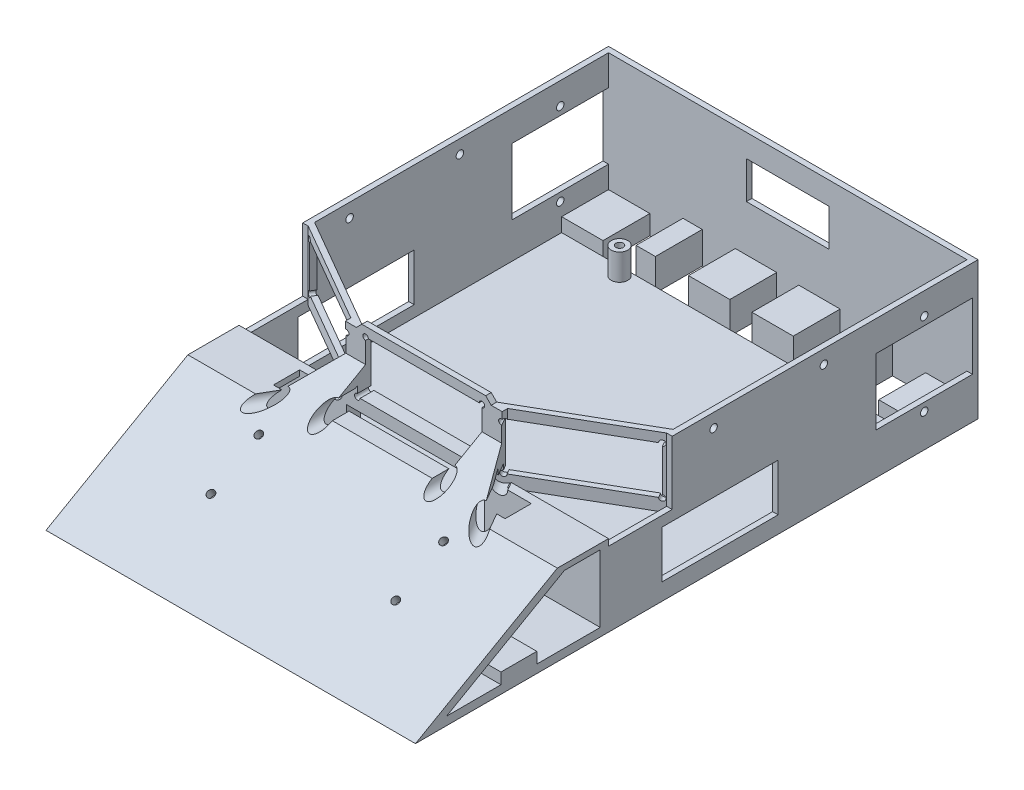
from build123d import *
from build123d.topology import SkipClean

# Parameters (mm, degrees)
SKETCH1_W                  = 130
SKETCH1_H                  = 130
BOSS_EXTRUDE1_DEPTH        = 2
SKETCH1_3_W                = 134
SKETCH1_3_H                = 134
SKETCH1_3_W_2              = 130
SKETCH1_3_H_2              = 130
BOSS_EXTRUDE2_DEPTH        = 50
BOSS_EXTRUDE3_DEPTH        = 134
SKETCH5_W                  = 50
SKETCH5_H                  = 25
CUT_EXTRUDE1_DEPTH         = 5
SKETCH9_R                  = 1.35
CUT_EXTRUDE4_DEPTH         = 3
SKETCH17_W                 = 30
SKETCH17_H                 = 13.5
CUT_EXTRUDE13_DEPTH        = 2
SKETCH19_W                 = 8
SKETCH19_H                 = 13
SKETCH19_R                 = 1.35
CUT_EXTRUDE15_DEPTH        = 3
SKETCH20_R                 = 1
SKETCH20_W                 = 42.2
SKETCH20_H                 = 17.2
FRONT_SENSOR_DEPTH         = 20
CUT_EXTRUDE18_START        = -22.3
SKETCH24_R                 = 3
CUT_EXTRUDE18_DEPTH        = 16.546693
SKETCH21_W                 = 44.9
SKETCH21_H                 = 2
BOSS_EXTRUDE9_DEPTH        = 2
SKETCH26_R                 = 1.35
SKETCH26_W                 = 6
SKETCH26_H                 = 11
SKETCH26_W_2               = 8
SKETCH26_H_2               = 1
SKETCH26_H_3               = 12
CUT_EXTRUDE19_DEPTH        = 2
BOSS_EXTRUDE10_DEPTH       = 25
SKETCH29_R                 = 1
SKETCH29_W                 = 42.2
SKETCH29_H                 = 17.2
CUT_EXTRUDE20_DEPTH        = 50
CUT_EXTRUDE21_DEPTH        = 23
CUT_EXTRUDE22_START        = -2
SKETCH31_R                 = 3
CUT_EXTRUDE22_DEPTH        = 33
CUT_EXTRUDE23_START        = -2
SKETCH32_R                 = 3
CUT_EXTRUDE23_DEPTH        = 33
BOSS_EXTRUDE11_DEPTH       = 25
SKETCH34_W                 = 4
SKETCH34_H                 = 13
CUT_EXTRUDE24_DEPTH        = 3
CUT_EXTRUDE25_START        = -134
SKETCH37_R                 = 1.35
SKETCH37_W                 = 35
SKETCH37_H                 = 24
SKETCH37_R_2               = 3
CUT_EXTRUDE25_DEPTH        = 134
SKETCH40_R                 = 3
CUT_EXTRUDE26_DEPTH        = 134
CUT_EXTRUDE27_REACH        = 200.567
SKETCH42_W                 = 42.2
SKETCH42_H                 = 17.2
CUT_EXTRUDE28_REACH        = 200.567
SKETCH44_R                 = 1.35
BOSS_EXTRUDE12_START       = -7
BOSS_EXTRUDE12_OUTLINE_W   = 17
BOSS_EXTRUDE12_OUTLINE_H   = 13
BOSS_EXTRUDE12_OUTLINE_W_2 = 15
BOSS_EXTRUDE12_OUTLINE_H_2 = 17
BOSS_EXTRUDE12_OUTLINE_W_3 = 7
BOSS_EXTRUDE12_OUTLINE_W_4 = 14.889316973
BOSS_EXTRUDE12_OUTLINE_W_5 = 7.110683027
BOSS_EXTRUDE12_OUTLINE_R   = 3
BOSS_EXTRUDE12_OUTLINE_R_2 = 1.35
BOSS_EXTRUDE12_DEPTH       = 5
SKETCH50_W                 = 4.6
SKETCH50_H                 = 13
CUT_EXTRUDE34_DEPTH        = 1.2
SKETCH51_R                 = 3.1
CUT_EXTRUDE35_DEPTH        = 1.2
SKETCH52_W                 = 12
SKETCH52_H                 = 5
SKETCH52_H_2               = 4
SKETCH52_W_2               = 8
CUT_EXTRUDE36_DEPTH        = 2
SKETCH53_R                 = 3
SKETCH53_R_2               = 1.35
SKETCH53_W                 = 7
SKETCH53_H                 = 17
SKETCH53_W_2               = 15
BOSS_EXTRUDE13_DEPTH       = 4.5


# Read off the part's stored shape, not the designer's step: Boss-Extrude12
with BuildPart() as part:
    # Sketch1 → Boss-Extrude1 (new body)
    with BuildSketch(Plane(origin=(0, 0, 0), x_dir=(1, 0, 0), z_dir=(0, 1, 0))):
        Rectangle(SKETCH1_W, SKETCH1_H)
    extrude(amount=BOSS_EXTRUDE1_DEPTH)

    # Sketch1<3> → Boss-Extrude2 (add)
    with BuildSketch(Plane(origin=(0, 0, 0), x_dir=(1, 0, 0), z_dir=(0, 1, 0))):
        Rectangle(SKETCH1_3_W, SKETCH1_3_H)
        Rectangle(SKETCH1_3_W_2, SKETCH1_3_H_2, mode=Mode.SUBTRACT)
    extrude(amount=BOSS_EXTRUDE2_DEPTH)

    # Sketch4 → Boss-Extrude3 (add)
    with BuildSketch(Plane(origin=(67, 0, 0), x_dir=(0, 0, -1), z_dir=(1, 0, 0))):
        Polygon((-137, 0), (-67, 0), (-67, 40), align=None)
        Polygon((-70, 34.830460965), (-125.703306689, 3), (-70, 3), align=None, mode=Mode.SUBTRACT)
    extrude(amount=-BOSS_EXTRUDE3_DEPTH)

    # Sketch5 → Cut-Extrude1 (cut)
    with BuildSketch(Plane(origin=(0, 0, 65), x_dir=(-1, 0, 0), z_dir=(0, 0, -1))):
        with Locations((0, 14.5)):
            Rectangle(SKETCH5_W, SKETCH5_H)
    extrude(amount=-CUT_EXTRUDE1_DEPTH, mode=Mode.SUBTRACT)

    # Sketch9 → Cut-Extrude4 (cut)
    with BuildSketch(Plane(origin=(0, 59.015384615, 33.723076923), x_dir=(1, 0, 0), z_dir=(0, 0.8682431421244593, 0.4961389383568338))):
        with Locations(Location((33.5, -68.63802173, 0), (0, 0, 270))):
            Circle(SKETCH9_R)
        with Locations(Location((-33.5, -68.63802173, 0), (0, 0, 270))):
            Circle(SKETCH9_R)
        with Locations(Location((33.5, -88.63802173, 0), (0, 0, 270))):
            Circle(SKETCH9_R)
        with Locations(Location((-33.5, -88.63802173, 0), (0, 0, 270))):
            Circle(SKETCH9_R)
    extrude(amount=-CUT_EXTRUDE4_DEPTH, mode=Mode.SUBTRACT)

    # Sketch17 → Cut-Extrude13 (cut)
    with BuildSketch(Plane(origin=(0, 0, -67), x_dir=(-1, 0, 0), z_dir=(0, 0, -1))):
        with Locations((0, 35)):
            Rectangle(SKETCH17_W, SKETCH17_H)
    extrude(amount=-CUT_EXTRUDE13_DEPTH, mode=Mode.SUBTRACT)

    # Sketch19 → Cut-Extrude15 (cut)
    with BuildSketch(Plane(origin=(0, 0, 0), x_dir=(-1, 0, 0), z_dir=(0, -1, 0))):
        Polygon((4, -106), (4, -105), (4, -93), (-4, -93), (-4, -106), align=None)
        with Locations((22.889316973, -99.5)):
            Rectangle(SKETCH19_W, SKETCH19_H)
        with Locations((46, -99.5)):
            Rectangle(SKETCH19_W, SKETCH19_H)
        with Locations((-22.889316973, -99.5)):
            Rectangle(SKETCH19_W, SKETCH19_H)
        with Locations((-46, -99.5)):
            Rectangle(SKETCH19_W, SKETCH19_H)
        with Locations(Location((41, -90, 0), (0, 0, 90))):
            Circle(SKETCH19_R)
        with Locations(Location((-41, -90, 0), (0, 0, 90))):
            Circle(SKETCH19_R)
    extrude(amount=-CUT_EXTRUDE15_DEPTH, mode=Mode.SUBTRACT)

    # Sketch20 → Front sensor (cut)
    with BuildSketch(Plane(origin=(0, 0, 65), x_dir=(-1, 0, 0), z_dir=(0, 0, -1))):
        with BuildLine():
            ThreePointArc((-20.1, 48.6), (-21.807106781, 49.307106781), (-21.1, 47.6))
            Line((-21.1, 47.6), (-21.1, 48.6))
            Line((-21.1, 48.6), (-20.1, 48.6))
        make_face()
        with BuildLine():
            Line((-21.1, 48.6), (-21.1, 47.6))
            ThreePointArc((-21.1, 47.6), (-20.392893219, 47.892893219), (-20.1, 48.6))
            Line((-20.1, 48.6), (-21.1, 48.6))
        make_face()
        with BuildLine():
            Line((-20.1, 31.4), (-21.1, 31.4))
            Line((-21.1, 31.4), (-21.1, 32.4))
            ThreePointArc((-21.1, 32.4), (-21.807106781, 30.692893219), (-20.1, 31.4))
        make_face()
        with BuildLine():
            Line((-21.1, 32.4), (-21.1, 31.4))
            Line((-21.1, 31.4), (-20.1, 31.4))
            ThreePointArc((-20.1, 31.4), (-20.392893219, 32.107106781), (-21.1, 32.4))
        make_face()
        with BuildLine():
            ThreePointArc((21.1, 32.4), (20.392893219, 32.107106781), (20.1, 31.4))
            Line((20.1, 31.4), (21.1, 31.4))
            Line((21.1, 31.4), (21.1, 32.4))
        make_face()
        with BuildLine():
            Line((21.1, 31.4), (20.1, 31.4))
            ThreePointArc((20.1, 31.4), (21.1, 30.4), (22.1, 31.4))
            ThreePointArc((22.1, 31.4), (21.807106781, 32.107106781), (21.1, 32.4))
            Line((21.1, 32.4), (21.1, 31.4))
        make_face()
        with BuildLine():
            ThreePointArc((22.1, 48.6), (21.1, 49.6), (20.1, 48.6))
            Line((20.1, 48.6), (21.1, 48.6))
            Line((21.1, 48.6), (21.1, 47.6))
            ThreePointArc((21.1, 47.6), (21.807106781, 47.892893219), (22.1, 48.6))
        make_face()
        with BuildLine():
            Line((21.1, 48.6), (20.1, 48.6))
            ThreePointArc((20.1, 48.6), (20.392893219, 47.892893219), (21.1, 47.6))
            Line((21.1, 47.6), (21.1, 48.6))
        make_face()
        with Locations((-21.1, 31.4)):
            Circle(SKETCH20_R)
        with Locations((21.1, 31.4)):
            Circle(SKETCH20_R)
        with Locations((21.1, 48.6)):
            Circle(SKETCH20_R)
        with Locations((-21.1, 48.6)):
            Circle(SKETCH20_R)
        with Locations((0, 40)):
            Rectangle(SKETCH20_W, SKETCH20_H)
    extrude(amount=-FRONT_SENSOR_DEPTH, mode=Mode.SUBTRACT)

    # Sketch24 → Cut-Extrude18 (cut)
    with BuildSketch(Plane(origin=(0, 0, 65), x_dir=(-1, 0, 0), z_dir=(0, 0, -1)).offset(CUT_EXTRUDE18_START)):
        with Locations((-21.1, 31.4)):
            Circle(SKETCH24_R)
        with Locations((21.1, 31.4)):
            Circle(SKETCH24_R)
    extrude(amount=CUT_EXTRUDE18_DEPTH, mode=Mode.SUBTRACT)

    # Sketch21 → Boss-Extrude9 (add)
    with BuildSketch(Plane(origin=(0, 0, 65), x_dir=(-1, 0, 0), z_dir=(0, 0, -1))):
        with Locations((0, 51)):
            Rectangle(SKETCH21_W, SKETCH21_H)
        Polygon((24.45, 50), (22.45, 50), (22.45, 52), align=None)
        Polygon((-22.45, 52), (-24.45, 50), (-22.45, 50), align=None)
    extrude(amount=-BOSS_EXTRUDE9_DEPTH)

    # Sketch26 → Cut-Extrude19 (cut)
    with BuildSketch(Plane(origin=(0, 0, 0), x_dir=(-1, 0, 0), z_dir=(0, -1, 0))):
        with Locations(Location((41, 45, 0), (0, 0, 90))):
            Circle(SKETCH26_R)
        with Locations((46, 54.5)):
            Rectangle(SKETCH26_W, SKETCH26_H)
        Polygon((43, 60), (42, 60), (42, 48), (50, 48), (50, 60), (49, 60), (49, 49), (43, 49), align=None)
        Polygon((20, 60), (19, 60), (19, 48), (27, 48), (27, 60), (26, 60), (26, 49), (20, 49), align=None)
        with Locations((23, 54.5)):
            Rectangle(SKETCH26_W, SKETCH26_H)
        Polygon((19, 61), (19, 60), (20, 60), (26, 60), (27, 60), (27, 61), align=None)
        with Locations((0, 54.5)):
            Rectangle(SKETCH26_W, SKETCH26_H)
        Polygon((-4, 48), (4, 48), (4, 60), (3, 60), (3, 49), (-3, 49), (-3, 60), (-4, 60), align=None)
        Polygon((3, 60), (4, 60), (4, 61), (-4, 61), (-4, 60), (-3, 60), align=None)
        with Locations((-23, 60.5)):
            Rectangle(SKETCH26_W_2, SKETCH26_H_2)
        with Locations((-23, 54)):
            Rectangle(SKETCH26_W_2, SKETCH26_H_3)
        with Locations((-46, 54)):
            Rectangle(SKETCH26_W_2, SKETCH26_H_3)
        with Locations((-46, 60.5)):
            Rectangle(SKETCH26_W_2, SKETCH26_H_2)
        with Locations(Location((-41, 45, 0), (0, 0, 90))):
            Circle(SKETCH26_R)
    extrude(amount=-CUT_EXTRUDE19_DEPTH, mode=Mode.SUBTRACT)

    # Sketch28 → Boss-Extrude10 (add)
    with BuildSketch(Plane(origin=(0, 50, 0), x_dir=(-1, 0, 0), z_dir=(0, 1, 0))):
        Polygon((24.45, 65), (65, 41.588446584), (65, 43.897847661), (28.45, 65), align=None)
        Polygon((-24.45, 65), (-28.45, 65), (-65, 43.897847661), (-65, 41.588446584), align=None)
    extrude(amount=-BOSS_EXTRUDE10_DEPTH)

    # Sketch29 → Cut-Extrude20 (cut)
    with BuildSketch(Plane(origin=(-34.258325623, 0, 59.337160561), x_dir=(-0.866025403784438, 3.4914813388431547e-15, -0.500000000000001), z_dir=(0.500000000000001, 6.047423072554937e-15, -0.866025403784438))):
        with Locations((33.185874538, 29.4)):
            Circle(SKETCH29_R)
        with Locations((33.185874538, 46.6)):
            Circle(SKETCH29_R)
        with Locations((-9.014125462, 46.6)):
            Circle(SKETCH29_R)
        with Locations((-9.014125462, 29.4)):
            Circle(SKETCH29_R)
        with Locations((12.085874538, 38)):
            Rectangle(SKETCH29_W, SKETCH29_H)
        with BuildLine():
            Line((-8.014125462, 46.6), (-9.014125462, 46.6))
            Line((-9.014125462, 46.6), (-9.014125462, 45.6))
            ThreePointArc((-9.014125462, 45.6), (-8.307018681, 45.892893219), (-8.014125462, 46.6))
        make_face()
        with BuildLine():
            Line((-9.014125462, 45.6), (-9.014125462, 46.6))
            Line((-9.014125462, 46.6), (-8.014125462, 46.6))
            ThreePointArc((-8.014125462, 46.6), (-9.721232243, 47.307106781), (-9.014125462, 45.6))
        make_face()
        with BuildLine():
            ThreePointArc((-8.014125462, 29.4), (-8.307018681, 30.107106781), (-9.014125462, 30.4))
            Line((-9.014125462, 30.4), (-9.014125462, 29.4))
            Line((-9.014125462, 29.4), (-8.014125462, 29.4))
        make_face()
        with BuildLine():
            Line((-9.014125462, 29.4), (-9.014125462, 30.4))
            ThreePointArc((-9.014125462, 30.4), (-9.721232243, 28.692893219), (-8.014125462, 29.4))
            Line((-8.014125462, 29.4), (-9.014125462, 29.4))
        make_face()
        with BuildLine():
            ThreePointArc((33.185874538, 30.4), (32.478767757, 30.107106781), (32.185874538, 29.4))
            Line((32.185874538, 29.4), (33.185874538, 29.4))
            Line((33.185874538, 29.4), (33.185874538, 30.4))
        make_face()
        with BuildLine():
            Line((33.185874538, 29.4), (32.185874538, 29.4))
            ThreePointArc((32.185874538, 29.4), (33.185874538, 28.4), (34.185874538, 29.4))
            ThreePointArc((34.185874538, 29.4), (33.892981319, 30.107106781), (33.185874538, 30.4))
            Line((33.185874538, 30.4), (33.185874538, 29.4))
        make_face()
        with BuildLine():
            ThreePointArc((34.185874538, 46.6), (33.185874538, 47.6), (32.185874538, 46.6))
            Line((32.185874538, 46.6), (33.185874538, 46.6))
            Line((33.185874538, 46.6), (33.185874538, 45.6))
            ThreePointArc((33.185874538, 45.6), (33.892981319, 45.892893219), (34.185874538, 46.6))
        make_face()
        with BuildLine():
            Line((33.185874538, 46.6), (32.185874538, 46.6))
            ThreePointArc((32.185874538, 46.6), (32.478767757, 45.892893219), (33.185874538, 45.6))
            Line((33.185874538, 45.6), (33.185874538, 46.6))
        make_face()
    cut_extrude20 = extrude(amount=-CUT_EXTRUDE20_DEPTH, mode=Mode.SUBTRACT)

    # Mirror2: Cut-Extrude20 across plane
    add(cut_extrude20.mirror(Plane(origin=(0, 0, 0), x_dir=(0, 0, 1), z_dir=(1, 0, 0))), mode=Mode.SUBTRACT)

    # Sketch30 → Cut-Extrude21 (cut)
    with BuildSketch(Plane(origin=(0, 50, 0), x_dir=(1, 0, 0), z_dir=(0, 1, 0))):
        Polygon((28.45, -65), (28.45, -67), (67, -67), (67, -43.897847661), (65, -43.897847661), (65, -65), align=None)
        Polygon((-28.45, -65), (-28.45, -67), (-67, -67), (-67, -43.897847661), (-65, -43.897847661), (-65, -65), align=None)
    extrude(amount=-CUT_EXTRUDE21_DEPTH, mode=Mode.SUBTRACT)

    # Sketch31 → Cut-Extrude22 (cut)
    with BuildSketch(Plane(origin=(-34.258325623, 0, 59.337160561), x_dir=(-0.866025403784438, 3.4914813388431547e-15, -0.500000000000001), z_dir=(0.500000000000001, 6.047423072554937e-15, -0.866025403784438)).offset(CUT_EXTRUDE22_START)):
        with Locations((-9.014125462, 29.4)):
            Circle(SKETCH31_R)
    extrude(amount=-CUT_EXTRUDE22_DEPTH, mode=Mode.SUBTRACT)

    # Sketch32 → Cut-Extrude23 (cut)
    with BuildSketch(Plane(origin=(34.258325623, 0, 59.337160561), x_dir=(-0.866025403784445, -3.491481338843042e-15, 0.49999999999998895), z_dir=(-0.49999999999998906, 6.047423072554938e-15, -0.8660254037844451)).offset(CUT_EXTRUDE23_START)):
        with Locations((9.014125462, 29.4)):
            Circle(SKETCH32_R)
    extrude(amount=-CUT_EXTRUDE23_DEPTH, mode=Mode.SUBTRACT)

    # Sketch33 → Boss-Extrude11 (add)
    with BuildSketch(Plane.ZY.offset(67)):
        Polygon((70, 29.4), (79.503306689, 29.4), (83.003306689, 27.4), (70, 27.4), align=None)
    boss_extrude11 = extrude(amount=-BOSS_EXTRUDE11_DEPTH)

    # Mirror5: Boss-Extrude11 across plane
    add(boss_extrude11.mirror(Plane(origin=(0, 0, 0), x_dir=(0, 0, 1), z_dir=(1, 0, 0))))

    # Sketch34 → Cut-Extrude24 (cut)
    with BuildSketch(Plane.XZ):
        with Locations((40, -54.5)):
            Rectangle(SKETCH34_W, SKETCH34_H)
        with Locations((29, -54.5)):
            Rectangle(SKETCH34_W, SKETCH34_H)
        with Locations((40, 99.5)):
            Rectangle(SKETCH34_W, SKETCH34_H)
        with Locations((28.889316973, 99.5)):
            Rectangle(SKETCH34_W, SKETCH34_H)
        with Locations((-28.889316973, 99.5)):
            Rectangle(SKETCH34_W, SKETCH34_H)
        with Locations((-40, 99.5)):
            Rectangle(SKETCH34_W, SKETCH34_H)
        with Locations((-40, -54.5)):
            Rectangle(SKETCH34_W, SKETCH34_H)
        with Locations((-29, -54.5)):
            Rectangle(SKETCH34_W, SKETCH34_H)
    extrude(amount=-CUT_EXTRUDE24_DEPTH, mode=Mode.SUBTRACT)

    # Sketch37 → Cut-Extrude25 (cut)
    # profile 1 of 3: a face of its own
    with BuildSketch(Plane(origin=(67, 0, 0), x_dir=(0, 0, -1), z_dir=(1, 0, 0)).offset(CUT_EXTRUDE25_START)):
        with Locations((47.5, 42)):
            Circle(SKETCH37_R)
    # profile 2 of 3: a face of its own
    with BuildSketch(Plane(origin=(67, 0, 0), x_dir=(0, 0, -1), z_dir=(1, 0, 0)).offset(CUT_EXTRUDE25_START)):
        with Locations(Location((47.5, 12, 0), (0, 0, 180))):
            Circle(SKETCH37_R)
    # profile 3 of 3: a face of its own
    with BuildSketch(Plane(origin=(67, 0, 0), x_dir=(0, 0, -1), z_dir=(1, 0, 0)).offset(CUT_EXTRUDE25_START)):
        with Locations((47.5, 27)):
            Rectangle(SKETCH37_W, SKETCH37_H)
        with Locations((53.8, 27)):
            Circle(SKETCH37_R_2, mode=Mode.SUBTRACT)
    extrude(amount=CUT_EXTRUDE25_DEPTH, mode=Mode.SUBTRACT)


with BuildPart() as cut_extrude25_piece_1:
    # of the separate pieces the step leaves, piece 1, a body of its own (cut_extrude25_pieces)
    add(part.part.solids().sort_by_distance((67, 0, -67))[0])

    # Cut-Extrude27: up to this face of the body (flat: up to its plane)
    cut_extrude27_end = Plane(cut_extrude25_piece_1.part.faces().sort_by_distance((-67, 22.291596904, 9.570849869))[0])
    # Sketch42 → Cut-Extrude27 (cut, up to the picked face)
    with BuildSketch(Plane(origin=(67, 0, 0), x_dir=(0, 0, -1), z_dir=(1, 0, 0)), mode=Mode.PRIVATE) as cut_extrude27_sk1:
        with Locations((-26.576274098, 14.7)):
            Rectangle(SKETCH42_W, SKETCH42_H)
    cut_extrude27_tool1 = split(extrude(cut_extrude27_sk1.sketch, amount=-CUT_EXTRUDE27_REACH, mode=Mode.PRIVATE), bisect_by=cut_extrude27_end, keep=Keep.BOTH, mode=Mode.PRIVATE)
    add(cut_extrude27_tool1.solids().sort_by(Axis((67, 14.7, 26.576274), (-1, 0, 0)))[0], mode=Mode.SUBTRACT)

    # Cut-Extrude28: up to this face of the body (flat: up to its plane)
    cut_extrude28_end = Plane(cut_extrude25_piece_1.part.faces().sort_by_distance((-67, 23.381701132, 7.128980907))[0])
    # Sketch44 → Cut-Extrude28 (cut, up to the picked face)
    with BuildSketch(Plane(origin=(67, 0, 0), x_dir=(0, 0, -1), z_dir=(1, 0, 0)), mode=Mode.PRIVATE) as cut_extrude28_sk1:
        with Locations((-28.897847661, 45)):
            Circle(SKETCH44_R)
    cut_extrude28_tool1 = split(extrude(cut_extrude28_sk1.sketch, amount=-CUT_EXTRUDE28_REACH, mode=Mode.PRIVATE), bisect_by=cut_extrude28_end, keep=Keep.BOTH, mode=Mode.PRIVATE)
    # Sketch44 → Cut-Extrude28 (cut, up to the picked face)
    with BuildSketch(Plane(origin=(67, 0, 0), x_dir=(0, 0, -1), z_dir=(1, 0, 0)), mode=Mode.PRIVATE) as cut_extrude28_sk2:
        with Locations((11.102152339, 45)):
            Circle(SKETCH44_R)
    cut_extrude28_tool2 = split(extrude(cut_extrude28_sk2.sketch, amount=-CUT_EXTRUDE28_REACH, mode=Mode.PRIVATE), bisect_by=cut_extrude28_end, keep=Keep.BOTH, mode=Mode.PRIVATE)
    add(cut_extrude28_tool1.solids().sort_by(Axis((67, 45, 28.897848), (-1, 0, 0)))[0], mode=Mode.SUBTRACT)
    add(cut_extrude28_tool2.solids().sort_by(Axis((67, 45, -11.102152), (-1, 0, 0)))[0], mode=Mode.SUBTRACT)

    # Boss-Extrude12 outline → Boss-Extrude12 (add)
    # profile 1 of 16: a face of its own
    with BuildSketch(Plane(origin=(0, 0, 0), x_dir=(-1, 0, 0), z_dir=(0, -1, 0)).offset(BOSS_EXTRUDE12_START)):
        with Locations((58.5, -99.5)):
            Rectangle(BOSS_EXTRUDE12_OUTLINE_W, BOSS_EXTRUDE12_OUTLINE_H)
    # profile 2 of 16: a face of its own
    with BuildSketch(Plane(origin=(0, 0, 0), x_dir=(-1, 0, 0), z_dir=(0, -1, 0)).offset(BOSS_EXTRUDE12_START)):
        with Locations((-58.5, -99.5)):
            Rectangle(BOSS_EXTRUDE12_OUTLINE_W, BOSS_EXTRUDE12_OUTLINE_H)
    # profile 3 of 16: a face of its own
    with BuildSketch(Plane(origin=(0, 0, 0), x_dir=(-1, 0, 0), z_dir=(0, -1, 0)).offset(BOSS_EXTRUDE12_START)):
        with Locations((-57.5, 56.5)):
            Rectangle(BOSS_EXTRUDE12_OUTLINE_W_2, BOSS_EXTRUDE12_OUTLINE_H_2)
    # profile 4 of 16: a face of its own
    with BuildSketch(Plane(origin=(0, 0, 0), x_dir=(-1, 0, 0), z_dir=(0, -1, 0)).offset(BOSS_EXTRUDE12_START)):
        with Locations((-34.5, 56.5)):
            Rectangle(BOSS_EXTRUDE12_OUTLINE_W_3, BOSS_EXTRUDE12_OUTLINE_H_2)
    # profile 5 of 16: a face of its own
    with BuildSketch(Plane(origin=(0, 0, 0), x_dir=(-1, 0, 0), z_dir=(0, -1, 0)).offset(BOSS_EXTRUDE12_START)):
        with Locations((-11.5, 56.5)):
            Rectangle(BOSS_EXTRUDE12_OUTLINE_W_2, BOSS_EXTRUDE12_OUTLINE_H_2)
    # profile 6 of 16: a face of its own
    with BuildSketch(Plane(origin=(0, 0, 0), x_dir=(-1, 0, 0), z_dir=(0, -1, 0)).offset(BOSS_EXTRUDE12_START)):
        with Locations((11.5, 56.5)):
            Rectangle(BOSS_EXTRUDE12_OUTLINE_W_2, BOSS_EXTRUDE12_OUTLINE_H_2)
    # profile 7 of 16: a face of its own
    with BuildSketch(Plane(origin=(0, 0, 0), x_dir=(-1, 0, 0), z_dir=(0, -1, 0)).offset(BOSS_EXTRUDE12_START)):
        with Locations((34.5, 56.5)):
            Rectangle(BOSS_EXTRUDE12_OUTLINE_W_3, BOSS_EXTRUDE12_OUTLINE_H_2)
    # profile 8 of 16: a face of its own
    with BuildSketch(Plane(origin=(0, 0, 0), x_dir=(-1, 0, 0), z_dir=(0, -1, 0)).offset(BOSS_EXTRUDE12_START)):
        with Locations((57.5, 56.5)):
            Rectangle(BOSS_EXTRUDE12_OUTLINE_W_2, BOSS_EXTRUDE12_OUTLINE_H_2)
    # profile 9 of 16: a face of its own
    with BuildSketch(Plane(origin=(0, 0, 0), x_dir=(-1, 0, 0), z_dir=(0, -1, 0)).offset(BOSS_EXTRUDE12_START)):
        with Locations((11.444658486, -99.5)):
            Rectangle(BOSS_EXTRUDE12_OUTLINE_W_4, BOSS_EXTRUDE12_OUTLINE_H)
    # profile 10 of 16: a face of its own
    with BuildSketch(Plane(origin=(0, 0, 0), x_dir=(-1, 0, 0), z_dir=(0, -1, 0)).offset(BOSS_EXTRUDE12_START)):
        with Locations((-11.444658486, -99.5)):
            Rectangle(BOSS_EXTRUDE12_OUTLINE_W_4, BOSS_EXTRUDE12_OUTLINE_H)
    # profile 11 of 16: a face of its own
    with BuildSketch(Plane(origin=(0, 0, 0), x_dir=(-1, 0, 0), z_dir=(0, -1, 0)).offset(BOSS_EXTRUDE12_START)):
        with Locations((-34.444658487, -99.5)):
            Rectangle(BOSS_EXTRUDE12_OUTLINE_W_5, BOSS_EXTRUDE12_OUTLINE_H)
    # profile 12 of 16: a face of its own
    with BuildSketch(Plane(origin=(0, 0, 0), x_dir=(-1, 0, 0), z_dir=(0, -1, 0)).offset(BOSS_EXTRUDE12_START)):
        with Locations((34.444658487, -99.5)):
            Rectangle(BOSS_EXTRUDE12_OUTLINE_W_5, BOSS_EXTRUDE12_OUTLINE_H)
    # profile 13 of 16: a face of its own
    with BuildSketch(Plane(origin=(0, 0, 0), x_dir=(-1, 0, 0), z_dir=(0, -1, 0)).offset(BOSS_EXTRUDE12_START)):
        with Locations((41, -90)):
            Circle(BOSS_EXTRUDE12_OUTLINE_R)
        with Locations((41, -90)):
            Circle(BOSS_EXTRUDE12_OUTLINE_R_2, mode=Mode.SUBTRACT)
    # profile 14 of 16: a face of its own
    with BuildSketch(Plane(origin=(0, 0, 0), x_dir=(-1, 0, 0), z_dir=(0, -1, 0)).offset(BOSS_EXTRUDE12_START)):
        with Locations((-41, -90)):
            Circle(BOSS_EXTRUDE12_OUTLINE_R)
        with Locations((-41, -90)):
            Circle(BOSS_EXTRUDE12_OUTLINE_R_2, mode=Mode.SUBTRACT)
    # profile 15 of 16: a face of its own
    with BuildSketch(Plane(origin=(0, 0, 0), x_dir=(-1, 0, 0), z_dir=(0, -1, 0)).offset(BOSS_EXTRUDE12_START)):
        with Locations((-41, 45)):
            Circle(BOSS_EXTRUDE12_OUTLINE_R)
        with Locations((-41, 45)):
            Circle(BOSS_EXTRUDE12_OUTLINE_R_2, mode=Mode.SUBTRACT)
    # profile 16 of 16: a face of its own
    with BuildSketch(Plane(origin=(0, 0, 0), x_dir=(-1, 0, 0), z_dir=(0, -1, 0)).offset(BOSS_EXTRUDE12_START)):
        with Locations((41, 45)):
            Circle(BOSS_EXTRUDE12_OUTLINE_R)
        with Locations((41, 45)):
            Circle(BOSS_EXTRUDE12_OUTLINE_R_2, mode=Mode.SUBTRACT)
    extrude(amount=BOSS_EXTRUDE12_DEPTH)

    # Sketch50 → Cut-Extrude34 (cut)
    with BuildSketch(Plane.XZ):
        with Locations((-35.7, 99.5)):
            Rectangle(SKETCH50_W, SKETCH50_H)
        with Locations((-52.3, 99.5)):
            Rectangle(SKETCH50_W, SKETCH50_H)
        with Locations((52.3, 99.5)):
            Rectangle(SKETCH50_W, SKETCH50_H)
        with Locations((35.7, 99.5)):
            Rectangle(SKETCH50_W, SKETCH50_H)
    extrude(amount=-CUT_EXTRUDE34_DEPTH, mode=Mode.SUBTRACT)

    # Sketch51 → Cut-Extrude35 (cut)
    with SkipClean():  # the faces are left unmerged after this step: merging them gives an invalid solid
        with BuildSketch(Plane(origin=(0, 0, 0), x_dir=(-1, 0, 0), z_dir=(0, -1, 0))):
            with Locations((-41, -90)):
                Circle(SKETCH51_R)
            with Locations((41, -90)):
                Circle(SKETCH51_R)
        extrude(amount=-CUT_EXTRUDE35_DEPTH, mode=Mode.SUBTRACT)

    # Sketch52 → Cut-Extrude36 (cut)
    with SkipClean():  # the faces are left unmerged after this step: merging them gives an invalid solid
        with BuildSketch(Plane(origin=(0, 2, 0), x_dir=(1, 0, 0), z_dir=(0, 1, 0))):
            with Locations((-44, 62.5)):
                Rectangle(SKETCH52_W, SKETCH52_H)
            with Locations((-25, 63)):
                Rectangle(SKETCH52_W, SKETCH52_H_2)
            with Locations((0, 63)):
                Rectangle(SKETCH52_W_2, SKETCH52_H_2)
            with Locations((25, 63)):
                Rectangle(SKETCH52_W, SKETCH52_H_2)
            with Locations((44, 63)):
                Rectangle(SKETCH52_W, SKETCH52_H_2)
        extrude(amount=-CUT_EXTRUDE36_DEPTH, mode=Mode.SUBTRACT)

    # Sketch53 → Boss-Extrude13 (add)
    # profile 1 of 6: a face of its own
    with SkipClean():  # the faces are left unmerged after this step: merging them gives an invalid solid
        with BuildSketch(Plane(origin=(0, 7, 0), x_dir=(1, 0, 0), z_dir=(0, 1, 0))):
            with Locations(Location((41, 45, 0), (0, 0, 90))):
                Circle(SKETCH53_R)
            with Locations(Location((41, 45, 0), (0, 0, 90))):
                Circle(SKETCH53_R_2, mode=Mode.SUBTRACT)
        # profile 2 of 6: a face of its own
        with BuildSketch(Plane(origin=(0, 7, 0), x_dir=(1, 0, 0), z_dir=(0, 1, 0))):
            with Locations(Location((-41, 45, 0), (0, 0, 90))):
                Circle(SKETCH53_R)
            with Locations(Location((-41, 45, 0), (0, 0, 90))):
                Circle(SKETCH53_R_2, mode=Mode.SUBTRACT)
        # profile 3 of 6: a face of its own
        with BuildSketch(Plane(origin=(0, 7, 0), x_dir=(1, 0, 0), z_dir=(0, 1, 0))):
            with Locations((34.5, 56.5)):
                Rectangle(SKETCH53_W, SKETCH53_H)
        # profile 4 of 6: a face of its own
        with BuildSketch(Plane(origin=(0, 7, 0), x_dir=(1, 0, 0), z_dir=(0, 1, 0))):
            with Locations((11.5, 56.5)):
                Rectangle(SKETCH53_W_2, SKETCH53_H)
        # profile 5 of 6: a face of its own
        with BuildSketch(Plane(origin=(0, 7, 0), x_dir=(1, 0, 0), z_dir=(0, 1, 0))):
            with Locations((-11.5, 56.5)):
                Rectangle(SKETCH53_W_2, SKETCH53_H)
        # profile 6 of 6: a face of its own
        with BuildSketch(Plane(origin=(0, 7, 0), x_dir=(1, 0, 0), z_dir=(0, 1, 0))):
            with Locations((-34.5, 56.5)):
                Rectangle(SKETCH53_W, SKETCH53_H)
        extrude(amount=BOSS_EXTRUDE13_DEPTH)


with BuildPart() as cut_extrude25_piece_2:
    # of the separate pieces the step leaves, piece 2, a body of its own (cut_extrude25_pieces)
    add(part.part.solids().sort_by_distance((67, 27, -56.8))[0])


with BuildPart() as cut_extrude25_piece_3:
    # of the separate pieces the step leaves, piece 3, a body of its own (cut_extrude25_pieces)
    add(part.part.solids().sort_by_distance((-67, 27, -56.8))[0])


with BuildPart() as cut_extrude26_tool:
    # Sketch40 → Cut-Extrude26 (new body)
    with BuildSketch(Plane(origin=(67, 0, 0), x_dir=(0, 0, -1), z_dir=(1, 0, 0))):
        with Locations((53.8, 27)):
            Circle(SKETCH40_R)
    extrude(amount=-CUT_EXTRUDE26_DEPTH)


with BuildPart() as cut_extrude25_piece_2_1:
    add(cut_extrude25_piece_2.part)

    # Cut-Extrude26: cut by cut_extrude26_tool
    add(cut_extrude26_tool.part, mode=Mode.SUBTRACT)


with BuildPart() as cut_extrude25_piece_3_1:
    add(cut_extrude25_piece_3.part)

    # Cut-Extrude26: cut by cut_extrude26_tool
    add(cut_extrude26_tool.part, mode=Mode.SUBTRACT)


solid = cut_extrude25_piece_1.part
